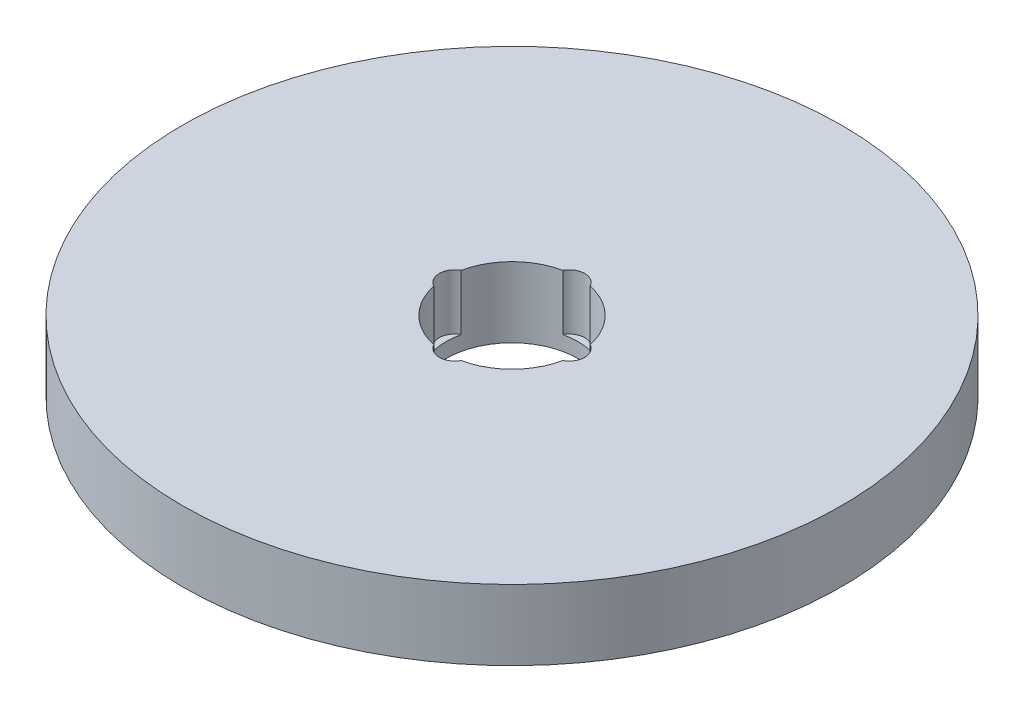
from build123d import *

# Parameters (mm, degrees)
SKETCH1_R           = 37.5
BOSS_EXTRUDE1_DEPTH = 8
SKETCH2_R           = 7.5
CUT_EXTRUDE1_DEPTH  = 54.633012222
SKETCH3_R           = 1.77006515
CUT_EXTRUDE2_DEPTH  = 6.331073371
CIRPATTERN1_COUNT   = 4


with BuildPart() as part:
    # Sketch1 → Boss-Extrude1 (new body)
    with BuildSketch(Plane(origin=(0, 0, 0), x_dir=(1, 0, 0), z_dir=(0, 1, 0))):
        Circle(SKETCH1_R)
    extrude(amount=BOSS_EXTRUDE1_DEPTH)

    # Sketch2 → Cut-Extrude1 (cut, through all)
    with BuildSketch(Plane(origin=(0, 0, 0), x_dir=(1, 0, 0), z_dir=(0, 1, 0))):
        Circle(SKETCH2_R)
    extrude(amount=CUT_EXTRUDE1_DEPTH, mode=Mode.SUBTRACT)

    # Sketch3 → Cut-Extrude2 (cut)
    with BuildSketch(Plane(origin=(0, 8, 0), x_dir=(1, 0, 0), z_dir=(0, 1, 0))):
        with Locations((-6.499273863, 0)):
            Circle(SKETCH3_R)
    cut_extrude2 = extrude(amount=-CUT_EXTRUDE2_DEPTH, mode=Mode.SUBTRACT)

    # CirPattern1: Cut-Extrude2 ×4 about axis
    cirpattern1_axis = Axis((0, 0, 0), (0, 1, 0))
    for i in range(1, CIRPATTERN1_COUNT):
        add(cut_extrude2.rotate(cirpattern1_axis, i * 360 / CIRPATTERN1_COUNT), mode=Mode.SUBTRACT)


solid = part.part
